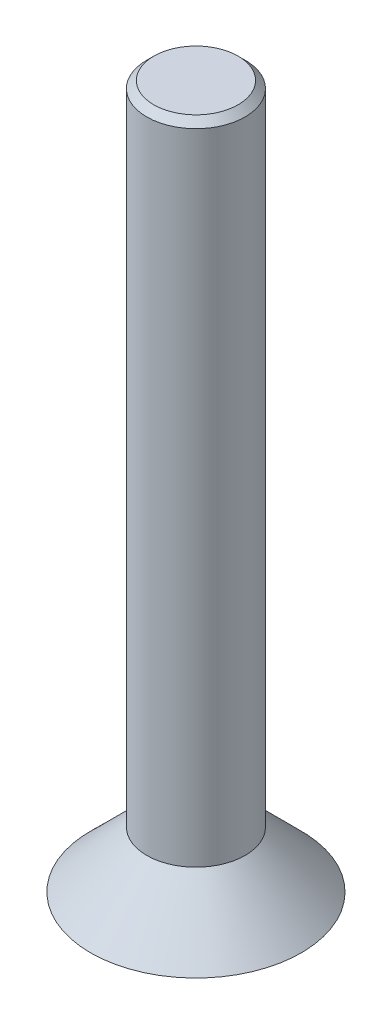
from build123d import *

# Parameters (mm, degrees)
SKETCH_1_R      = 3
EXTRUDE_1_DEPTH = 1.6
CHAMFER_1_SIZE  = 1.6
SKETCH_2_R      = 1.4
EXTRUDE_2_DEPTH = 18.4
CHAMFER_2_SIZE  = 0.2


with BuildPart() as part:
    # 草图1 → 凸台-拉伸1 (new body)
    with BuildSketch(Plane(origin=(0, 0, 0), x_dir=(1, 0, 0), z_dir=(0, 1, 0))):
        with Locations(Location((0, 0, 0), (0, 0, 270))):
            Circle(SKETCH_1_R)
        Polygon((0, -1.154700538), (1, -0.577350269), (1, 0.577350269), (0, 1.154700538), (-1, 0.577350269), (-1, -0.577350269), align=None, mode=Mode.SUBTRACT)
    extrude(amount=EXTRUDE_1_DEPTH)

    # 倒角1
    # the kernel refuses this chamfer: 1.6 mm, written as the material it takes off along each edge
    with BuildSketch(Plane(origin=(0, 1.6, 0), x_dir=(0, 0, 1), z_dir=(-1, 0, 0))) as chamfer_1_piece_1:
        Polygon((3, -CHAMFER_1_SIZE), (3 - CHAMFER_1_SIZE, 0), (3, 0), align=None)
    revolve(axis=Axis((0, 1.6, 0), (0, 1, 0)), mode=Mode.SUBTRACT)

    # 草图2 → 凸台-拉伸2 (add)
    with BuildSketch(Plane(origin=(0, 1.6, 0), x_dir=(1, 0, 0), z_dir=(0, 1, 0))):
        with Locations(Location((0, 0, 0), (0, 0, 270))):
            Circle(SKETCH_2_R)
    extrude(amount=EXTRUDE_2_DEPTH)

    # 倒角2
    chamfer_2_edges = [part.edges().sort_by_distance(p)[0] for p in [
        (0, 20, -1.4),
    ]]
    chamfer(chamfer_2_edges, length=CHAMFER_2_SIZE)


solid = part.part
